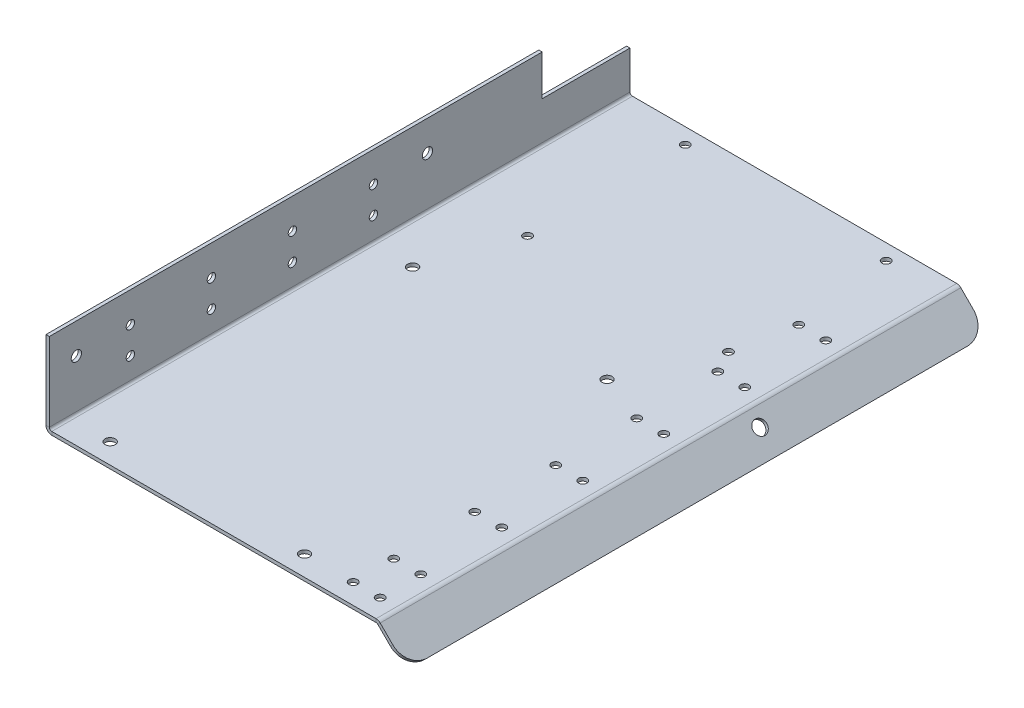
from build123d import *

# Parameters (mm, degrees)
BASE_FLANGE1_DEPTH              = 136.525
CE_00_FEED_CONTROL_REACH        = 221.994
SKETCH8_R                       = 2.3876
CE_00_CRYO_CONTROL_REACH        = 221.994
SKETCH9_R                       = 1.9812
CE_00_HOLE_MOUNT_FLANGE_REACH   = 221.994
SKETCH10_R                      = 2.4257
SKETCH12_R                      = 3.175
CE_00_HOLE_MOUNT_TOP_DEPTH      = 2.54
CE_00_HOLE_EXTRA_ON_PANEL_REACH = 221.994
SKETCH11_R                      = 1.9812
CE_00_NOTCH_REACH               = 221.994
SKETCH13_W                      = 51.292163309
SKETCH13_H                      = 53.183412621
FILLET1_R                       = 9.525
CUT_EXTRUDE1_REACH              = 221.994
SKETCH14_R                      = 1.9812


# Sheet-metal steps are written as plain solids
with BuildPart() as part:
    # Sketch3 → Base-Flange1 (new, symmetric)
    with BuildSketch(Plane.XY):
        with BuildLine():
            Line((0, 38.1), (0, 1.143))
            ThreePointArc((0, 1.143), (0.334776949, 0.334776949), (1.143, 0))
            Line((1.143, 0), (153.643889868, 0))
            ThreePointArc((153.643889868, 0), (154.68880698, -0.207846936), (155.574644934, -0.799744934))
            Line((155.574644934, -0.799744934), (168.245284182, -13.470384182))
            Line((168.245284182, -13.470384182), (167.122752166, -14.592916197))
            Line((167.122752166, -14.592916197), (154.452112919, -1.922276949))
            ThreePointArc((154.452112919, -1.922276949), (154.081297031, -1.674505694), (153.643889868, -1.5875))
            Line((153.643889868, -1.5875), (1.143, -1.5875))
            ThreePointArc((1.143, -1.5875), (-0.787755066, -0.787755066), (-1.5875, 1.143))
            Line((-1.5875, 1.143), (-1.5875, 38.1))
            Line((-1.5875, 38.1), (0, 38.1))
        make_face()
    extrude(amount=BASE_FLANGE1_DEPTH, both=True)

    # Sketch8 → CE-00 Feed Control (cut, up to next)
    with BuildSketch(Plane(origin=(0, 0, 0), x_dir=(1, 0, 0), z_dir=(0, 1, 0)), mode=Mode.PRIVATE) as ce_00_feed_control_sk1:
        with Locations(Location((19.05, 15.24, 0), (0, 0, 270))):
            Circle(SKETCH8_R)
    ce_00_feed_control_tool1 = extrude(ce_00_feed_control_sk1.sketch, amount=-CE_00_FEED_CONTROL_REACH, mode=Mode.PRIVATE) & part.part
    # Sketch8 → CE-00 Feed Control (cut, up to next)
    with BuildSketch(Plane(origin=(0, 0, 0), x_dir=(1, 0, 0), z_dir=(0, 1, 0)), mode=Mode.PRIVATE) as ce_00_feed_control_sk2:
        with Locations(Location((19.05, -127, 0), (0, 0, 270))):
            Circle(SKETCH8_R)
    ce_00_feed_control_tool2 = extrude(ce_00_feed_control_sk2.sketch, amount=-CE_00_FEED_CONTROL_REACH, mode=Mode.PRIVATE) & part.part
    # Sketch8 → CE-00 Feed Control (cut, up to next)
    with BuildSketch(Plane(origin=(0, 0, 0), x_dir=(1, 0, 0), z_dir=(0, 1, 0)), mode=Mode.PRIVATE) as ce_00_feed_control_sk3:
        with Locations(Location((110.49, -127, 0), (0, 0, 270))):
            Circle(SKETCH8_R)
    ce_00_feed_control_tool3 = extrude(ce_00_feed_control_sk3.sketch, amount=-CE_00_FEED_CONTROL_REACH, mode=Mode.PRIVATE) & part.part
    # Sketch8 → CE-00 Feed Control (cut, up to next)
    with BuildSketch(Plane(origin=(0, 0, 0), x_dir=(1, 0, 0), z_dir=(0, 1, 0)), mode=Mode.PRIVATE) as ce_00_feed_control_sk4:
        with Locations(Location((110.49, 15.24, 0), (0, 0, 270))):
            Circle(SKETCH8_R)
    ce_00_feed_control_tool4 = extrude(ce_00_feed_control_sk4.sketch, amount=-CE_00_FEED_CONTROL_REACH, mode=Mode.PRIVATE) & part.part
    add(ce_00_feed_control_tool1.solids().sort_by_distance((19.05, 0, -15.24))[0], mode=Mode.SUBTRACT)
    add(ce_00_feed_control_tool2.solids().sort_by_distance((19.05, 0, 127))[0], mode=Mode.SUBTRACT)
    add(ce_00_feed_control_tool3.solids().sort_by_distance((110.49, 0, 127))[0], mode=Mode.SUBTRACT)
    add(ce_00_feed_control_tool4.solids().sort_by_distance((110.49, 0, -15.24))[0], mode=Mode.SUBTRACT)

    # Sketch9 → CE-00 Cryo Control (cut, up to next)
    with BuildSketch(Plane(origin=(0, 0, 0), x_dir=(1, 0, 0), z_dir=(0, 1, 0)), mode=Mode.PRIVATE) as ce_00_cryo_control_sk1:
        with Locations(Location((127.8382, 129.159, 0), (0, 0, 270))):
            Circle(SKETCH9_R)
    ce_00_cryo_control_tool1 = extrude(ce_00_cryo_control_sk1.sketch, amount=-CE_00_CRYO_CONTROL_REACH, mode=Mode.PRIVATE) & part.part
    # Sketch9 → CE-00 Cryo Control (cut, up to next)
    with BuildSketch(Plane(origin=(0, 0, 0), x_dir=(1, 0, 0), z_dir=(0, 1, 0)), mode=Mode.PRIVATE) as ce_00_cryo_control_sk2:
        with Locations(Location((33.3502, 129.159, 0), (0, 0, 270))):
            Circle(SKETCH9_R)
    ce_00_cryo_control_tool2 = extrude(ce_00_cryo_control_sk2.sketch, amount=-CE_00_CRYO_CONTROL_REACH, mode=Mode.PRIVATE) & part.part
    # Sketch9 → CE-00 Cryo Control (cut, up to next)
    with BuildSketch(Plane(origin=(0, 0, 0), x_dir=(1, 0, 0), z_dir=(0, 1, 0)), mode=Mode.PRIVATE) as ce_00_cryo_control_sk3:
        with Locations(Location((33.3502, 54.991, 0), (0, 0, 270))):
            Circle(SKETCH9_R)
    ce_00_cryo_control_tool3 = extrude(ce_00_cryo_control_sk3.sketch, amount=-CE_00_CRYO_CONTROL_REACH, mode=Mode.PRIVATE) & part.part
    # Sketch9 → CE-00 Cryo Control (cut, up to next)
    with BuildSketch(Plane(origin=(0, 0, 0), x_dir=(1, 0, 0), z_dir=(0, 1, 0)), mode=Mode.PRIVATE) as ce_00_cryo_control_sk4:
        with Locations(Location((127.8382, 54.991, 0), (0, 0, 270))):
            Circle(SKETCH9_R)
    ce_00_cryo_control_tool4 = extrude(ce_00_cryo_control_sk4.sketch, amount=-CE_00_CRYO_CONTROL_REACH, mode=Mode.PRIVATE) & part.part
    add(ce_00_cryo_control_tool1.solids().sort_by_distance((127.8382, 0, -129.159))[0], mode=Mode.SUBTRACT)
    add(ce_00_cryo_control_tool2.solids().sort_by_distance((33.3502, 0, -129.159))[0], mode=Mode.SUBTRACT)
    add(ce_00_cryo_control_tool3.solids().sort_by_distance((33.3502, 0, -54.991))[0], mode=Mode.SUBTRACT)
    add(ce_00_cryo_control_tool4.solids().sort_by_distance((127.8382, 0, -54.991))[0], mode=Mode.SUBTRACT)

    # Sketch10 → CE-00 Hole Mount Flange (cut, up to next)
    with BuildSketch(Plane(origin=(0, 0, 0), x_dir=(0, 0, -1), z_dir=(1, 0, 0)), mode=Mode.PRIVATE) as ce_00_hole_mount_flange_sk1:
        with Locations((-123.825, 23.8252)):
            Circle(SKETCH10_R)
    ce_00_hole_mount_flange_tool1 = extrude(ce_00_hole_mount_flange_sk1.sketch, amount=-CE_00_HOLE_MOUNT_FLANGE_REACH, mode=Mode.PRIVATE) & part.part
    # Sketch10 → CE-00 Hole Mount Flange (cut, up to next)
    with BuildSketch(Plane(origin=(0, 0, 0), x_dir=(0, 0, -1), z_dir=(1, 0, 0)), mode=Mode.PRIVATE) as ce_00_hole_mount_flange_sk2:
        with Locations((41.275, 23.8252)):
            Circle(SKETCH10_R)
    ce_00_hole_mount_flange_tool2 = extrude(ce_00_hole_mount_flange_sk2.sketch, amount=-CE_00_HOLE_MOUNT_FLANGE_REACH, mode=Mode.PRIVATE) & part.part
    add(ce_00_hole_mount_flange_tool1.solids().sort_by_distance((0, 23.8252, 123.825))[0], mode=Mode.SUBTRACT)
    add(ce_00_hole_mount_flange_tool2.solids().sort_by_distance((0, 23.8252, -41.275))[0], mode=Mode.SUBTRACT)

    # Sketch12 → CE-00 Hole Mount Top (cut)
    with BuildSketch(Plane(origin=(77.38745, 77.38745, 0), x_dir=(0, 0, -1), z_dir=(0.7071067811865487, 0.7071067811865465, 0))):
        with Locations(Location((37.2872, -117.367181347, 0), (0, 0, 90))):
            Circle(SKETCH12_R)
    extrude(amount=-CE_00_HOLE_MOUNT_TOP_DEPTH, mode=Mode.SUBTRACT)

    # Sketch11 → CE-00 Hole Extra on Panel (cut, up to next)
    with BuildSketch(Plane(origin=(0, 0, 0), x_dir=(1, 0, 0), z_dir=(0, 1, 0)), mode=Mode.PRIVATE) as ce_00_hole_extra_on_panel_sk1:
        with Locations(Location((146.05, -127, 0), (0, 0, 270))):
            Circle(SKETCH11_R)
    ce_00_hole_extra_on_panel_tool1 = extrude(ce_00_hole_extra_on_panel_sk1.sketch, amount=-CE_00_HOLE_EXTRA_ON_PANEL_REACH, mode=Mode.PRIVATE) & part.part
    # Sketch11 → CE-00 Hole Extra on Panel (cut, up to next)
    with BuildSketch(Plane(origin=(0, 0, 0), x_dir=(1, 0, 0), z_dir=(0, 1, 0)), mode=Mode.PRIVATE) as ce_00_hole_extra_on_panel_sk2:
        with Locations(Location((146.05, -107.95, 0), (0, 0, 270))):
            Circle(SKETCH11_R)
    ce_00_hole_extra_on_panel_tool2 = extrude(ce_00_hole_extra_on_panel_sk2.sketch, amount=-CE_00_HOLE_EXTRA_ON_PANEL_REACH, mode=Mode.PRIVATE) & part.part
    # Sketch11 → CE-00 Hole Extra on Panel (cut, up to next)
    with BuildSketch(Plane(origin=(0, 0, 0), x_dir=(1, 0, 0), z_dir=(0, 1, 0)), mode=Mode.PRIVATE) as ce_00_hole_extra_on_panel_sk3:
        with Locations(Location((146.05, -69.85, 0), (0, 0, 270))):
            Circle(SKETCH11_R)
    ce_00_hole_extra_on_panel_tool3 = extrude(ce_00_hole_extra_on_panel_sk3.sketch, amount=-CE_00_HOLE_EXTRA_ON_PANEL_REACH, mode=Mode.PRIVATE) & part.part
    # Sketch11 → CE-00 Hole Extra on Panel (cut, up to next)
    with BuildSketch(Plane(origin=(0, 0, 0), x_dir=(1, 0, 0), z_dir=(0, 1, 0)), mode=Mode.PRIVATE) as ce_00_hole_extra_on_panel_sk4:
        with Locations(Location((146.05, -31.75, 0), (0, 0, 270))):
            Circle(SKETCH11_R)
    ce_00_hole_extra_on_panel_tool4 = extrude(ce_00_hole_extra_on_panel_sk4.sketch, amount=-CE_00_HOLE_EXTRA_ON_PANEL_REACH, mode=Mode.PRIVATE) & part.part
    # Sketch11 → CE-00 Hole Extra on Panel (cut, up to next)
    with BuildSketch(Plane(origin=(0, 0, 0), x_dir=(1, 0, 0), z_dir=(0, 1, 0)), mode=Mode.PRIVATE) as ce_00_hole_extra_on_panel_sk5:
        with Locations(Location((146.05, 44.45, 0), (0, 0, 270))):
            Circle(SKETCH11_R)
    ce_00_hole_extra_on_panel_tool5 = extrude(ce_00_hole_extra_on_panel_sk5.sketch, amount=-CE_00_HOLE_EXTRA_ON_PANEL_REACH, mode=Mode.PRIVATE) & part.part
    # Sketch11 → CE-00 Hole Extra on Panel (cut, up to next)
    with BuildSketch(Plane(origin=(0, 0, 0), x_dir=(1, 0, 0), z_dir=(0, 1, 0)), mode=Mode.PRIVATE) as ce_00_hole_extra_on_panel_sk6:
        with Locations(Location((146.05, 82.55, 0), (0, 0, 270))):
            Circle(SKETCH11_R)
    ce_00_hole_extra_on_panel_tool6 = extrude(ce_00_hole_extra_on_panel_sk6.sketch, amount=-CE_00_HOLE_EXTRA_ON_PANEL_REACH, mode=Mode.PRIVATE) & part.part
    # Sketch11 → CE-00 Hole Extra on Panel (cut, up to next)
    with BuildSketch(Plane(origin=(0, 0, 0), x_dir=(1, 0, 0), z_dir=(0, 1, 0)), mode=Mode.PRIVATE) as ce_00_hole_extra_on_panel_sk7:
        with Locations(Location((146.05, 6.35, 0), (0, 0, 270))):
            Circle(SKETCH11_R)
    ce_00_hole_extra_on_panel_tool7 = extrude(ce_00_hole_extra_on_panel_sk7.sketch, amount=-CE_00_HOLE_EXTRA_ON_PANEL_REACH, mode=Mode.PRIVATE) & part.part
    # Sketch11 → CE-00 Hole Extra on Panel (cut, up to next)
    with BuildSketch(Plane(origin=(0, 0, 0), x_dir=(1, 0, 0), z_dir=(0, 1, 0)), mode=Mode.PRIVATE) as ce_00_hole_extra_on_panel_sk8:
        with Locations(Location((133.35, 6.35, 0), (0, 0, 270))):
            Circle(SKETCH11_R)
    ce_00_hole_extra_on_panel_tool8 = extrude(ce_00_hole_extra_on_panel_sk8.sketch, amount=-CE_00_HOLE_EXTRA_ON_PANEL_REACH, mode=Mode.PRIVATE) & part.part
    # Sketch11 → CE-00 Hole Extra on Panel (cut, up to next)
    with BuildSketch(Plane(origin=(0, 0, 0), x_dir=(1, 0, 0), z_dir=(0, 1, 0)), mode=Mode.PRIVATE) as ce_00_hole_extra_on_panel_sk9:
        with Locations(Location((133.35, -31.75, 0), (0, 0, 270))):
            Circle(SKETCH11_R)
    ce_00_hole_extra_on_panel_tool9 = extrude(ce_00_hole_extra_on_panel_sk9.sketch, amount=-CE_00_HOLE_EXTRA_ON_PANEL_REACH, mode=Mode.PRIVATE) & part.part
    # Sketch11 → CE-00 Hole Extra on Panel (cut, up to next)
    with BuildSketch(Plane(origin=(0, 0, 0), x_dir=(1, 0, 0), z_dir=(0, 1, 0)), mode=Mode.PRIVATE) as ce_00_hole_extra_on_panel_sk10:
        with Locations(Location((133.35, -69.85, 0), (0, 0, 270))):
            Circle(SKETCH11_R)
    ce_00_hole_extra_on_panel_tool10 = extrude(ce_00_hole_extra_on_panel_sk10.sketch, amount=-CE_00_HOLE_EXTRA_ON_PANEL_REACH, mode=Mode.PRIVATE) & part.part
    # Sketch11 → CE-00 Hole Extra on Panel (cut, up to next)
    with BuildSketch(Plane(origin=(0, 0, 0), x_dir=(1, 0, 0), z_dir=(0, 1, 0)), mode=Mode.PRIVATE) as ce_00_hole_extra_on_panel_sk11:
        with Locations(Location((133.35, -107.95, 0), (0, 0, 270))):
            Circle(SKETCH11_R)
    ce_00_hole_extra_on_panel_tool11 = extrude(ce_00_hole_extra_on_panel_sk11.sketch, amount=-CE_00_HOLE_EXTRA_ON_PANEL_REACH, mode=Mode.PRIVATE) & part.part
    # Sketch11 → CE-00 Hole Extra on Panel (cut, up to next)
    with BuildSketch(Plane(origin=(0, 0, 0), x_dir=(1, 0, 0), z_dir=(0, 1, 0)), mode=Mode.PRIVATE) as ce_00_hole_extra_on_panel_sk12:
        with Locations(Location((133.35, -127, 0), (0, 0, 270))):
            Circle(SKETCH11_R)
    ce_00_hole_extra_on_panel_tool12 = extrude(ce_00_hole_extra_on_panel_sk12.sketch, amount=-CE_00_HOLE_EXTRA_ON_PANEL_REACH, mode=Mode.PRIVATE) & part.part
    # Sketch11 → CE-00 Hole Extra on Panel (cut, up to next)
    with BuildSketch(Plane(origin=(0, 0, 0), x_dir=(1, 0, 0), z_dir=(0, 1, 0)), mode=Mode.PRIVATE) as ce_00_hole_extra_on_panel_sk13:
        with Locations(Location((133.35, 82.55, 0), (0, 0, 270))):
            Circle(SKETCH11_R)
    ce_00_hole_extra_on_panel_tool13 = extrude(ce_00_hole_extra_on_panel_sk13.sketch, amount=-CE_00_HOLE_EXTRA_ON_PANEL_REACH, mode=Mode.PRIVATE) & part.part
    # Sketch11 → CE-00 Hole Extra on Panel (cut, up to next)
    with BuildSketch(Plane(origin=(0, 0, 0), x_dir=(1, 0, 0), z_dir=(0, 1, 0)), mode=Mode.PRIVATE) as ce_00_hole_extra_on_panel_sk14:
        with Locations(Location((133.35, 44.45, 0), (0, 0, 270))):
            Circle(SKETCH11_R)
    ce_00_hole_extra_on_panel_tool14 = extrude(ce_00_hole_extra_on_panel_sk14.sketch, amount=-CE_00_HOLE_EXTRA_ON_PANEL_REACH, mode=Mode.PRIVATE) & part.part
    add(ce_00_hole_extra_on_panel_tool1.solids().sort_by_distance((146.05, 0, 127))[0], mode=Mode.SUBTRACT)
    add(ce_00_hole_extra_on_panel_tool2.solids().sort_by_distance((146.05, 0, 107.95))[0], mode=Mode.SUBTRACT)
    add(ce_00_hole_extra_on_panel_tool3.solids().sort_by_distance((146.05, 0, 69.85))[0], mode=Mode.SUBTRACT)
    add(ce_00_hole_extra_on_panel_tool4.solids().sort_by_distance((146.05, 0, 31.75))[0], mode=Mode.SUBTRACT)
    add(ce_00_hole_extra_on_panel_tool5.solids().sort_by_distance((146.05, 0, -44.45))[0], mode=Mode.SUBTRACT)
    add(ce_00_hole_extra_on_panel_tool6.solids().sort_by_distance((146.05, 0, -82.55))[0], mode=Mode.SUBTRACT)
    add(ce_00_hole_extra_on_panel_tool7.solids().sort_by_distance((146.05, 0, -6.35))[0], mode=Mode.SUBTRACT)
    add(ce_00_hole_extra_on_panel_tool8.solids().sort_by_distance((133.35, 0, -6.35))[0], mode=Mode.SUBTRACT)
    add(ce_00_hole_extra_on_panel_tool9.solids().sort_by_distance((133.35, 0, 31.75))[0], mode=Mode.SUBTRACT)
    add(ce_00_hole_extra_on_panel_tool10.solids().sort_by_distance((133.35, 0, 69.85))[0], mode=Mode.SUBTRACT)
    add(ce_00_hole_extra_on_panel_tool11.solids().sort_by_distance((133.35, 0, 107.95))[0], mode=Mode.SUBTRACT)
    add(ce_00_hole_extra_on_panel_tool12.solids().sort_by_distance((133.35, 0, 127))[0], mode=Mode.SUBTRACT)
    add(ce_00_hole_extra_on_panel_tool13.solids().sort_by_distance((133.35, 0, -82.55))[0], mode=Mode.SUBTRACT)
    add(ce_00_hole_extra_on_panel_tool14.solids().sort_by_distance((133.35, 0, -44.45))[0], mode=Mode.SUBTRACT)

    # Sketch13 → CE-00 Notch (cut, up to next)
    with BuildSketch(Plane(origin=(0, 0, 0), x_dir=(0, 0, -1), z_dir=(1, 0, 0)), mode=Mode.PRIVATE) as ce_00_notch_sk1:
        with Locations((120.896081655, 45.64170631)):
            Rectangle(SKETCH13_W, SKETCH13_H)
    ce_00_notch_tool1 = extrude(ce_00_notch_sk1.sketch, amount=-CE_00_NOTCH_REACH, mode=Mode.PRIVATE) & part.part
    add(ce_00_notch_tool1.solids().sort_by_distance((0, 45.641706, -120.896082))[0], mode=Mode.SUBTRACT)

    # Fillet1
    fillet1_edges = [part.edges().sort_by_distance(p)[0] for p in [
        (167.684018174, -14.031650189, -136.525),
        (167.684018174, -14.031650189, 136.525),
    ]]
    fillet(fillet1_edges, radius=FILLET1_R)

    # Sketch14 → Cut-Extrude1 (cut, up to next)
    with BuildSketch(Plane(origin=(0, 0, 0), x_dir=(0, 0, -1), z_dir=(1, 0, 0)), mode=Mode.PRIVATE) as cut_extrude1_sk1:
        with Locations((-98.425, 23.8252)):
            Circle(SKETCH14_R)
    cut_extrude1_tool1 = extrude(cut_extrude1_sk1.sketch, amount=-CUT_EXTRUDE1_REACH, mode=Mode.PRIVATE) & part.part
    # Sketch14 → Cut-Extrude1 (cut, up to next)
    with BuildSketch(Plane(origin=(0, 0, 0), x_dir=(0, 0, -1), z_dir=(1, 0, 0)), mode=Mode.PRIVATE) as cut_extrude1_sk2:
        with Locations((-60.325, 23.8252)):
            Circle(SKETCH14_R)
    cut_extrude1_tool2 = extrude(cut_extrude1_sk2.sketch, amount=-CUT_EXTRUDE1_REACH, mode=Mode.PRIVATE) & part.part
    # Sketch14 → Cut-Extrude1 (cut, up to next)
    with BuildSketch(Plane(origin=(0, 0, 0), x_dir=(0, 0, -1), z_dir=(1, 0, 0)), mode=Mode.PRIVATE) as cut_extrude1_sk3:
        with Locations((-22.225, 23.8252)):
            Circle(SKETCH14_R)
    cut_extrude1_tool3 = extrude(cut_extrude1_sk3.sketch, amount=-CUT_EXTRUDE1_REACH, mode=Mode.PRIVATE) & part.part
    # Sketch14 → Cut-Extrude1 (cut, up to next)
    with BuildSketch(Plane(origin=(0, 0, 0), x_dir=(0, 0, -1), z_dir=(1, 0, 0)), mode=Mode.PRIVATE) as cut_extrude1_sk4:
        with Locations((15.875, 23.8252)):
            Circle(SKETCH14_R)
    cut_extrude1_tool4 = extrude(cut_extrude1_sk4.sketch, amount=-CUT_EXTRUDE1_REACH, mode=Mode.PRIVATE) & part.part
    # Sketch14 → Cut-Extrude1 (cut, up to next)
    with BuildSketch(Plane(origin=(0, 0, 0), x_dir=(0, 0, -1), z_dir=(1, 0, 0)), mode=Mode.PRIVATE) as cut_extrude1_sk5:
        with Locations((15.875, 11.1252)):
            Circle(SKETCH14_R)
    cut_extrude1_tool5 = extrude(cut_extrude1_sk5.sketch, amount=-CUT_EXTRUDE1_REACH, mode=Mode.PRIVATE) & part.part
    # Sketch14 → Cut-Extrude1 (cut, up to next)
    with BuildSketch(Plane(origin=(0, 0, 0), x_dir=(0, 0, -1), z_dir=(1, 0, 0)), mode=Mode.PRIVATE) as cut_extrude1_sk6:
        with Locations((-22.225, 11.1252)):
            Circle(SKETCH14_R)
    cut_extrude1_tool6 = extrude(cut_extrude1_sk6.sketch, amount=-CUT_EXTRUDE1_REACH, mode=Mode.PRIVATE) & part.part
    # Sketch14 → Cut-Extrude1 (cut, up to next)
    with BuildSketch(Plane(origin=(0, 0, 0), x_dir=(0, 0, -1), z_dir=(1, 0, 0)), mode=Mode.PRIVATE) as cut_extrude1_sk7:
        with Locations((-60.325, 11.1252)):
            Circle(SKETCH14_R)
    cut_extrude1_tool7 = extrude(cut_extrude1_sk7.sketch, amount=-CUT_EXTRUDE1_REACH, mode=Mode.PRIVATE) & part.part
    # Sketch14 → Cut-Extrude1 (cut, up to next)
    with BuildSketch(Plane(origin=(0, 0, 0), x_dir=(0, 0, -1), z_dir=(1, 0, 0)), mode=Mode.PRIVATE) as cut_extrude1_sk8:
        with Locations((-98.425, 11.1252)):
            Circle(SKETCH14_R)
    cut_extrude1_tool8 = extrude(cut_extrude1_sk8.sketch, amount=-CUT_EXTRUDE1_REACH, mode=Mode.PRIVATE) & part.part
    add(cut_extrude1_tool1.solids().sort_by_distance((0, 23.8252, 98.425))[0], mode=Mode.SUBTRACT)
    add(cut_extrude1_tool2.solids().sort_by_distance((0, 23.8252, 60.325))[0], mode=Mode.SUBTRACT)
    add(cut_extrude1_tool3.solids().sort_by_distance((0, 23.8252, 22.225))[0], mode=Mode.SUBTRACT)
    add(cut_extrude1_tool4.solids().sort_by_distance((0, 23.8252, -15.875))[0], mode=Mode.SUBTRACT)
    add(cut_extrude1_tool5.solids().sort_by_distance((0, 11.1252, -15.875))[0], mode=Mode.SUBTRACT)
    add(cut_extrude1_tool6.solids().sort_by_distance((0, 11.1252, 22.225))[0], mode=Mode.SUBTRACT)
    add(cut_extrude1_tool7.solids().sort_by_distance((0, 11.1252, 60.325))[0], mode=Mode.SUBTRACT)
    add(cut_extrude1_tool8.solids().sort_by_distance((0, 11.1252, 98.425))[0], mode=Mode.SUBTRACT)


solid = part.part
